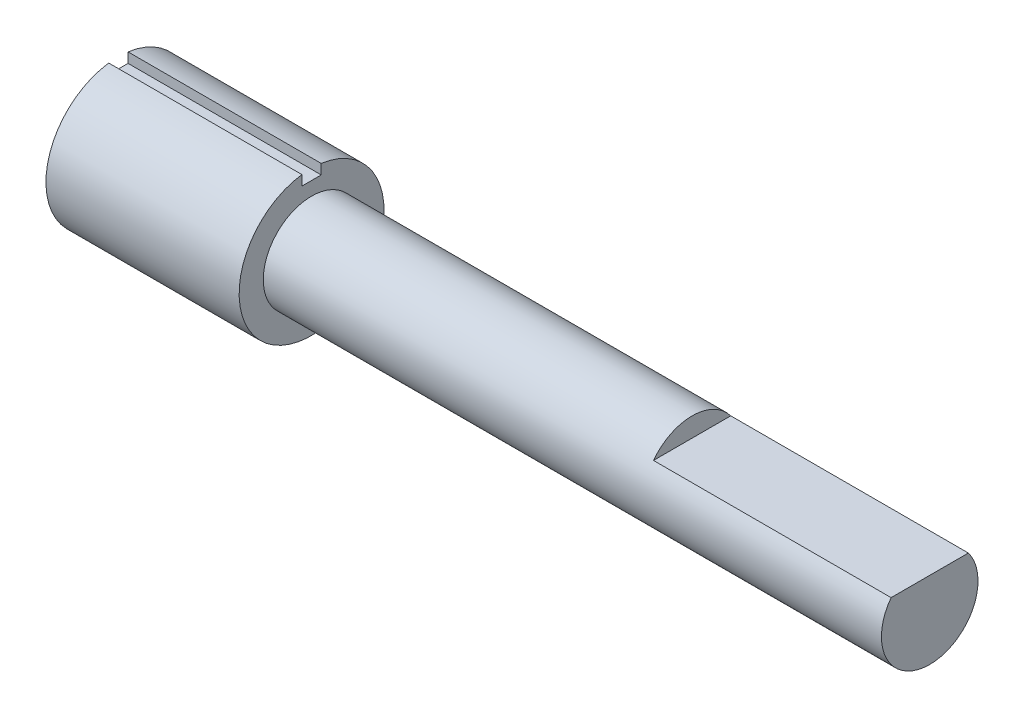
from build123d import *

# Parameters (mm, degrees)
SKETCH1_R           = 4.7625
BOSS_EXTRUDE1_DEPTH = 12.7
SKETCH2_R           = 2.54
CUT_EXTRUDE1_DEPTH  = 9.525
SKETCH3_R           = 3.175
BOSS_EXTRUDE2_DEPTH = 40.64
CUT_EXTRUDE2_START  = -15.621
CUT_EXTRUDE2_DEPTH  = 15.621
SKETCH23_W          = 1.269740297
SKETCH23_H          = 0.762
CUT_EXTRUDE11_DEPTH = 12.7


with BuildPart() as part:
    # Sketch1 → Boss-Extrude1 (new body)
    with BuildSketch(Plane(origin=(0, 0, 0), x_dir=(0, 0, -1), z_dir=(1, 0, 0))):
        Circle(SKETCH1_R)
    extrude(amount=BOSS_EXTRUDE1_DEPTH)

    # Sketch2 → Cut-Extrude1 (cut)
    with BuildSketch(Plane.ZY):
        Circle(SKETCH2_R)
    extrude(amount=-CUT_EXTRUDE1_DEPTH, mode=Mode.SUBTRACT)

    # Sketch3 → Boss-Extrude2 (add)
    with BuildSketch(Plane(origin=(12.7, 0, 0), x_dir=(0, 0, -1), z_dir=(1, 0, 0))):
        Circle(SKETCH3_R)
    extrude(amount=BOSS_EXTRUDE2_DEPTH)

    # Sketch5 → Cut-Extrude2 (cut)
    with BuildSketch(Plane(origin=(53.34, 0, 0), x_dir=(0, 0, -1), z_dir=(1, 0, 0)).offset(CUT_EXTRUDE2_START)):
        with BuildLine():
            Line((-2.54, 1.905), (2.54, 1.905))
            ThreePointArc((2.54, 1.905), (0, 3.175), (-2.54, 1.905))
        make_face()
    extrude(amount=CUT_EXTRUDE2_DEPTH, mode=Mode.SUBTRACT)

    # Sketch23 → Cut-Extrude11 (cut)
    with BuildSketch(Plane(origin=(12.7, 0, 0), x_dir=(0, 0, -1), z_dir=(1, 0, 0))):
        with Locations((0.000129852, 4.445000077)):
            Rectangle(SKETCH23_W, SKETCH23_H)
    extrude(amount=-CUT_EXTRUDE11_DEPTH, mode=Mode.SUBTRACT)


solid = part.part
